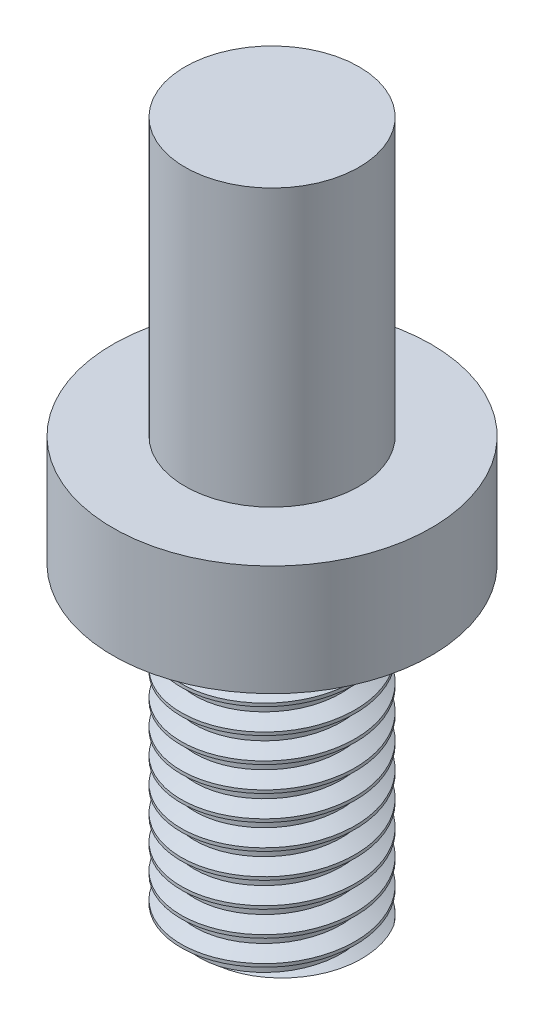
from build123d import *

# Parameters (mm, degrees)
THREAD1_PITCH = 0.907142857
THREAD1_TO    = 12


with BuildPart() as part:
    # Sketch1 → Revolve1 (revolve)
    with BuildSketch(Plane.XY, mode=Mode.PRIVATE) as revolve1_sk:
        Polygon((0, -12.5), (0, 12.5), (3.15, 12.5), (3.15, 2.5), (5.759297521, 2.5), (5.759297521, -1.5), (3.15, -1.5), (3.15, -12.5), align=None)
    revolve(revolve1_sk.sketch.rotate(Axis((0, -12.5, 0), (0, 1, 0)), 90), axis=Axis((0, -12.5, 0), (0, 1, 0)))

    # Thread1: arcs per turn and ends read off the stored shape
    # Thread1: the profile of Thread Profile1 profile screwed along a right-hand helix through 13.228346 turns, 8 arcs to a turn; built about Z, then put on its axis
    thread1_z = Axis((0, 0, 0), (0, 0, 1))
    thread1_corners = [(3.1503, 0, -0.000173205), (3.1503, 0, 0.793923203), (2.658994528, 0, 0.510267856), (2.658994528, 0, 0.283482142)]
    with BuildLine(mode=Mode.PRIVATE) as thread1_profile:
        Line(thread1_corners[0], thread1_corners[1])
        Line(thread1_corners[1], thread1_corners[2])
        Line(thread1_corners[2], thread1_corners[3])
        Line(thread1_corners[3], thread1_corners[0])
    thread1_cap = Face(thread1_profile.wire())
    thread1_turn_angles = [0, 22.5, 45, 67.5, 90, 112.5, 135, 157.5, 180, 202.5, 225, 247.5, 270, 292.5, 315, 337.5, 360]
    thread1_turn_weights = [1, 0.9238795325112867, 1, 0.9238795325112867, 1, 0.9238795325112867, 1, 0.9238795325112867, 1, 0.9238795325112867, 1, 0.9238795325112867, 1, 0.9238795325112867, 1, 0.9238795325112867, 1]
    thread1_turn_rails = [Edge.make_bspline([Vector(p[0], p[1], 0).rotate(thread1_z, thread1_turn_angles[k]) / thread1_turn_weights[k] + Vector(0, 0, p[2] + THREAD1_PITCH * thread1_turn_angles[k] / 360) for k in range(17)], [0, 0, 0, 1, 1, 2, 2, 3, 3, 4, 4, 5, 5, 6, 6, 7, 7, 8, 8, 8], 2, thread1_turn_weights) for p in thread1_corners]
    thread1_turn_sides = [Face.make_surface_from_curves(thread1_turn_rails[p[0]], thread1_turn_rails[p[1]]) for p in [(0, 1), (1, 2), (2, 3), (3, 0)]]
    thread1_last_angles = [4680, 4702.5, 4725, 4743.602362205, 4762.204724409]
    thread1_last_weights = [1, 0.9238795325112867, 1, 0.9477552590699362, 1]
    thread1_last_rails = [Edge.make_bspline([Vector(p[0], p[1], 0).rotate(thread1_z, thread1_last_angles[k]) / thread1_last_weights[k] + Vector(0, 0, p[2] + THREAD1_PITCH * thread1_last_angles[k] / 360) for k in range(5)], [0, 0, 0, 1, 1, 2, 2, 2], 2, thread1_last_weights) for p in thread1_corners]
    thread1_last_sides = [Face.make_surface_from_curves(thread1_last_rails[p[0]], thread1_last_rails[p[1]]) for p in [(0, 1), (1, 2), (2, 3), (3, 0)]]
    thread1 = Plane(origin=(0, -13.5, 0), x_dir=(1, 0, 0), z_dir=(0, 1, 0)) * split(Solid(Shell([*[p.moved(Location((0, 0, THREAD1_PITCH * i))) for i in range(13) for p in thread1_turn_sides], *thread1_last_sides, thread1_cap, thread1_cap.rotate(thread1_z, 4762.204724409).moved(Location((0, 0, THREAD1_PITCH * 4762.204724409 / 360)))])), bisect_by=Plane.XY.offset(THREAD1_TO), keep=Keep.BOTTOM, mode=Mode.PRIVATE)
    add(thread1, mode=Mode.SUBTRACT)


solid = part.part
